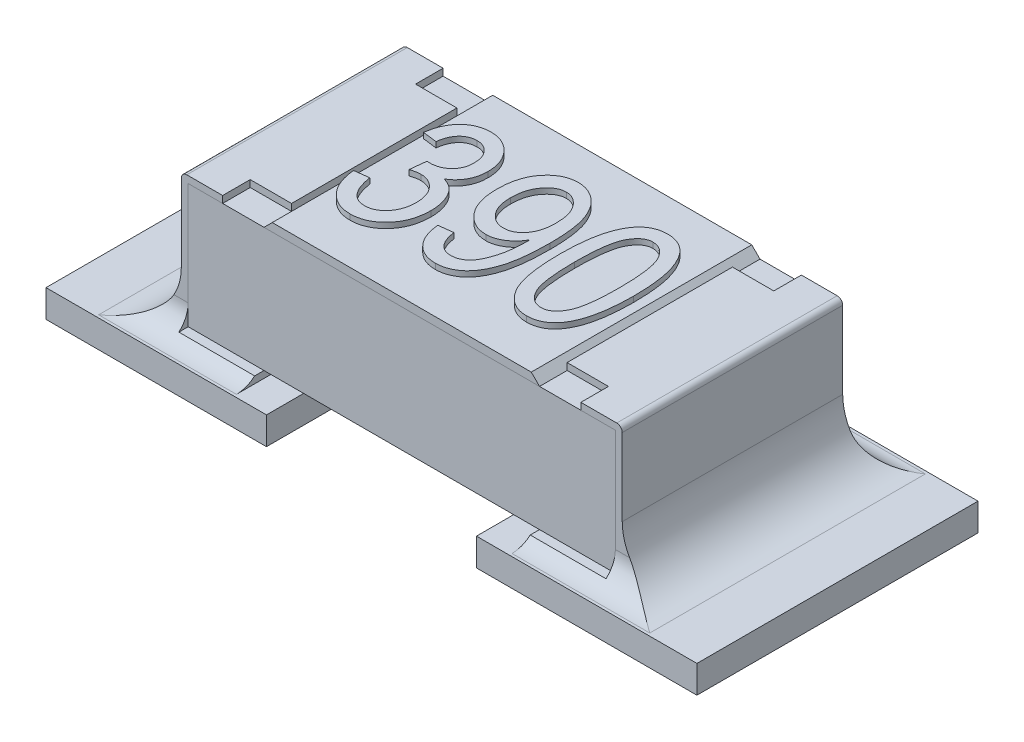
from build123d import *

# Parameters (mm, degrees)
SKETCH1_W             = 0.8
SKETCH1_H             = 0.45
BOSS_EXTRUDE1_DEPTH   = 0.775
BOSS_EXTRUDE2_DEPTH   = 0.4
BOSS_EXTRUDE2_2_DEPTH = 0.4
SKETCH3_W             = 0.15
SKETCH3_H             = 0.1
CUT_EXTRUDE1_DEPTH    = 0.025
BOSS_EXTRUDE3_DEPTH   = 0.4
SKETCH7_W             = 0.8
SKETCH7_H             = 1.02
BOSS_EXTRUDE5_DEPTH   = 0.1
FILLET3_R             = 0.2
FILLET4_R             = 0.2
FILLET5_R             = 0.1
FILLET6_R             = 0.1
BOSS_EXTRU_1_DEPTH    = 0.02


with BuildPart() as part:
    # Sketch1 → Boss-Extrude1 (new, symmetric)
    with BuildSketch(Plane(origin=(0, 0, 0), x_dir=(0, 0, -1), z_dir=(1, 0, 0))):
        with Locations((0, 0.35)):
            Rectangle(SKETCH1_W, SKETCH1_H)
    extrude(amount=BOSS_EXTRUDE1_DEPTH, both=True)


with BuildPart() as body_2:
    # Sketch2 → Boss-Extrude2 (new, symmetric)
    with BuildSketch(Plane.XY):
        with BuildLine():
            Line((-0.5, 0.6), (-0.78, 0.6))
            ThreePointArc((-0.78, 0.6), (-0.794142136, 0.594142136), (-0.8, 0.58))
            Line((-0.8, 0.58), (-0.8, 0.1))
            Line((-0.8, 0.1), (-0.5, 0.1))
            Line((-0.5, 0.1), (-0.5, 0.125))
            Line((-0.5, 0.125), (-0.775, 0.125))
            Line((-0.775, 0.125), (-0.775, 0.575))
            Line((-0.775, 0.575), (-0.5, 0.575))
            Line((-0.5, 0.575), (-0.5, 0.6))
        make_face()
    extrude(amount=BOSS_EXTRUDE2_DEPTH, both=True)


with BuildPart() as body_3:
    # Sketch2 → Boss-Extrude2 2 (new, symmetric)
    with BuildSketch(Plane.XY):
        with BuildLine():
            Line((0.5, 0.575), (0.5, 0.6))
            Line((0.5, 0.6), (0.78, 0.6))
            ThreePointArc((0.78, 0.6), (0.794142136, 0.594142136), (0.8, 0.58))
            Line((0.8, 0.58), (0.8, 0.1))
            Line((0.8, 0.1), (0.5, 0.1))
            Line((0.5, 0.1), (0.5, 0.125))
            Line((0.5, 0.125), (0.775, 0.125))
            Line((0.775, 0.125), (0.775, 0.575))
            Line((0.775, 0.575), (0.5, 0.575))
        make_face()
    extrude(amount=BOSS_EXTRUDE2_2_DEPTH, both=True)


with BuildPart() as cut_extrude1_tool:
    # Sketch3 → Cut-Extrude1 (new body)
    with BuildSketch(Plane(origin=(0, 0.6, 0), x_dir=(1, 0, 0), z_dir=(0, 1, 0))):
        with Locations((-0.575, 0.35)):
            Rectangle(SKETCH3_W, SKETCH3_H)
        with Locations((-0.575, -0.35)):
            Rectangle(SKETCH3_W, SKETCH3_H)
        with Locations((0.575, -0.35)):
            Rectangle(SKETCH3_W, SKETCH3_H)
        with Locations((0.575, 0.35)):
            Rectangle(SKETCH3_W, SKETCH3_H)
    extrude(amount=-CUT_EXTRUDE1_DEPTH)


with BuildPart() as body_2_1:
    add(body_2.part)

    # Cut-Extrude1: cut by cut_extrude1_tool
    add(cut_extrude1_tool.part, mode=Mode.SUBTRACT)



with BuildPart() as body_3_1:
    add(body_3.part)

    # Cut-Extrude1: cut by cut_extrude1_tool
    add(cut_extrude1_tool.part, mode=Mode.SUBTRACT)


with BuildPart() as body_4:
    # Sketch4 → Boss-Extrude3 (new, symmetric)
    with BuildSketch(Plane.XY):
        Polygon((-0.5, 0.575), (0.5, 0.575), (0.47, 0.605), (-0.47, 0.605), align=None)
    extrude(amount=BOSS_EXTRUDE3_DEPTH, both=True)

    # Esquisse2 → Boss.-Extru.1 (add)
    # profile 1 of 3: a face of its own
    with BuildSketch(Plane(origin=(0, 0.605, 0), x_dir=(1, 0, 0), z_dir=(0, 1, 0))):
        with BuildLine():
            Line((-0.465730847, -0.108858251), (-0.413782795, -0.102364745))
            add(Edge.make_bspline(
                [(-0.413782795, -0.102364745), (-0.413112807, -0.106295854), (-0.411807247, -0.113956147), (-0.409238482, -0.124979634), (-0.406434917, -0.135294754), (-0.403185523, -0.144804398), (-0.399643589, -0.153601456), (-0.395715823, -0.161629834), (-0.391324435, -0.16888819), (-0.386577518, -0.175380729), (-0.38146041, -0.181138198), (-0.375996387, -0.186122883), (-0.370134278, -0.190331218), (-0.363929963, -0.193833451), (-0.357285261, -0.196431554), (-0.350330728, -0.198414424), (-0.34296418, -0.199517263), (-0.337927194, -0.199682771), (-0.335353412, -0.199767342)],
                knots=[0, 0, 0, 0, 1.392235382, 2.712957193, 3.95076201, 5.123471921, 6.220028287, 7.260520794, 8.240826993, 9.178593426, 10.065213643, 10.926376853, 11.755607984, 12.580369742, 13.407158359, 14.241002189, 15.101193065, 16, 16, 16, 16], degree=3))
            add(Edge.make_bspline(
                [(-0.335353412, -0.199767342), (-0.332538353, -0.19971378), (-0.327005308, -0.199608502), (-0.318897007, -0.198040126), (-0.311019345, -0.195898939), (-0.303508158, -0.192563959), (-0.296231184, -0.188466115), (-0.289179307, -0.183522145), (-0.282629652, -0.177410194), (-0.27625154, -0.170691575), (-0.270368923, -0.163232894), (-0.265296718, -0.155086373), (-0.261024926, -0.146371416), (-0.257440303, -0.137192254), (-0.254875092, -0.127399682), (-0.252761962, -0.117188858), (-0.251701981, -0.106343944), (-0.251532173, -0.098950673), (-0.251445133, -0.095161011)],
                knots=[0, 0, 0, 0, 0.904038564, 1.776903143, 2.648138989, 3.525264603, 4.411852617, 5.332561374, 6.2875971, 7.288147468, 8.311042921, 9.337403868, 10.368883854, 11.429611823, 12.501164111, 13.621320171, 14.780729868, 16, 16, 16, 16], degree=3))
            add(Edge.make_bspline(
                [(-0.251445133, -0.095161011), (-0.25153714, -0.091607761), (-0.251716276, -0.084689696), (-0.252701551, -0.074570464), (-0.254506809, -0.064983483), (-0.257204132, -0.05595494), (-0.260398267, -0.047345761), (-0.264475323, -0.03933172), (-0.269286493, -0.031866947), (-0.274729563, -0.025004423), (-0.280738993, -0.018819667), (-0.287076675, -0.013314715), (-0.293845368, -0.008739927), (-0.300874508, -0.004887872), (-0.308355784, -0.002118976), (-0.316071181, 8.4992e-05), (-0.324187909, 0.00130226), (-0.329701668, 0.001454003), (-0.332512503, 0.001531359)],
                knots=[0, 0, 0, 0, 1.208507307, 2.352925112, 3.453685551, 4.520081629, 5.553915499, 6.572344605, 7.570902253, 8.569592363, 9.545641393, 10.499968035, 11.418701314, 12.319183888, 13.218416966, 14.125267075, 15.044288268, 16, 16, 16, 16], degree=3))
            add(Edge.make_bspline(
                [(-0.332512503, 0.001531359), (-0.335054222, 0.001451368), (-0.340472466, 0.001280848), (-0.349004264, -0.00019382), (-0.358446302, -0.00226645), (-0.36492643, -0.004300299), (-0.36832825, -0.005367991)],
                knots=[0, 0, 0, 0, 0.832645691, 1.774971563, 2.831945141, 4, 4, 4, 4], degree=3))
            Line((-0.36832825, -0.005367991), (-0.361834743, 0.053479411))
            Line((-0.361834743, 0.053479411), (-0.354022243, 0.052769184))
            add(Edge.make_bspline(
                [(-0.354022243, 0.052769184), (-0.351007427, 0.052803375), (-0.3451245, 0.052870094), (-0.336520608, 0.054103025), (-0.328313169, 0.05573649), (-0.320585221, 0.058215582), (-0.313242826, 0.06126306), (-0.30640038, 0.06512583), (-0.29993305, 0.069629935), (-0.293956478, 0.074775592), (-0.288591253, 0.080592975), (-0.283798464, 0.086838036), (-0.279836815, 0.093608382), (-0.27654485, 0.100771608), (-0.274020674, 0.108431244), (-0.272178554, 0.116547048), (-0.271199422, 0.125154849), (-0.27101847, 0.131027254), (-0.270925652, 0.134039476)],
                knots=[0, 0, 0, 0, 1.104467345, 2.155189185, 3.181695374, 4.170183668, 5.126157628, 6.092295424, 7.04536858, 8.012620263, 8.977961638, 9.942904556, 10.893715412, 11.848320646, 12.828840281, 13.845861792, 14.895045293, 16, 16, 16, 16], degree=3))
            add(Edge.make_bspline(
                [(-0.270925652, 0.134039476), (-0.271158483, 0.139435179), (-0.271605941, 0.149804754), (-0.275040698, 0.164574052), (-0.281025918, 0.177647183), (-0.289265332, 0.188824396), (-0.299180409, 0.19783145), (-0.310256724, 0.204581268), (-0.322540697, 0.208580551), (-0.331097189, 0.209072848), (-0.335454873, 0.209323567)],
                knots=[0, 0, 0, 0, 1.168747258, 2.246123166, 3.262822778, 4.26410748, 5.234436762, 6.148309006, 7.056963545, 8, 8, 8, 8], degree=3))
            add(Edge.make_bspline(
                [(-0.335454873, 0.209323567), (-0.339982901, 0.209113033), (-0.348791484, 0.208703473), (-0.361387188, 0.204796436), (-0.372975385, 0.198811303), (-0.381422708, 0.191612698), (-0.387408859, 0.184797154), (-0.391632537, 0.179053945), (-0.395385645, 0.172667561), (-0.39856643, 0.165580977), (-0.401627761, 0.157989828), (-0.403792773, 0.149635141), (-0.405955263, 0.14077154), (-0.4068352, 0.134590959), (-0.407289289, 0.131401489)],
                knots=[0, 0, 0, 0, 1.389180941, 2.702438466, 4.019316734, 5.377896697, 6.085434137, 6.807430375, 7.567469407, 8.358691296, 9.195188439, 10.081130764, 11.009773198, 12, 12, 12, 12], degree=3))
            Line((-0.407289289, 0.131401489), (-0.459237341, 0.137894996))
            add(Edge.make_bspline(
                [(-0.459237341, 0.137894996), (-0.458386725, 0.142845406), (-0.456727429, 0.152502178), (-0.453260772, 0.166397742), (-0.44913499, 0.179379068), (-0.444139657, 0.191374675), (-0.438467682, 0.202488701), (-0.432050369, 0.212674243), (-0.424971305, 0.221998173), (-0.416984552, 0.230202962), (-0.408495978, 0.237510554), (-0.399500655, 0.243821526), (-0.39015896, 0.249253588), (-0.380316923, 0.25362975), (-0.370066957, 0.257099842), (-0.359357741, 0.259528187), (-0.348244302, 0.260963741), (-0.340701236, 0.261168011), (-0.336875328, 0.261271619)],
                knots=[0, 0, 0, 0, 1.259750421, 2.457396855, 3.589696629, 4.673763457, 5.713494597, 6.716289503, 7.690389722, 8.644478697, 9.583164327, 10.496506905, 11.397350125, 12.289843847, 13.194037124, 14.107891875, 15.040306322, 16, 16, 16, 16], degree=3))
            add(Edge.make_bspline(
                [(-0.336875328, 0.261271619), (-0.332844064, 0.261152706), (-0.324913169, 0.260918763), (-0.313256414, 0.259123737), (-0.302045795, 0.256325888), (-0.291311157, 0.252246796), (-0.281147915, 0.246873647), (-0.271305727, 0.240572938), (-0.261950545, 0.233023939), (-0.25322899, 0.224349983), (-0.245223381, 0.214858231), (-0.238201607, 0.204659864), (-0.232170532, 0.193927052), (-0.227381442, 0.18250432), (-0.22363811, 0.170506984), (-0.22090271, 0.157915535), (-0.219227721, 0.144704426), (-0.219062239, 0.135701715), (-0.2189776, 0.131097106)],
                knots=[0, 0, 0, 0, 0.987546189, 1.94284647, 2.883618689, 3.814886987, 4.749064414, 5.696240478, 6.674807358, 7.688712876, 8.706405422, 9.713376545, 10.718845743, 11.717906576, 12.742863162, 13.794678478, 14.872046121, 16, 16, 16, 16], degree=3))
            add(Edge.make_bspline(
                [(-0.2189776, 0.131097106), (-0.219133893, 0.12553723), (-0.219439131, 0.114678872), (-0.222381301, 0.09892791), (-0.227050518, 0.084150815), (-0.233562923, 0.070445878), (-0.241678138, 0.057883508), (-0.251425525, 0.046771364), (-0.262549879, 0.036921642), (-0.271008348, 0.031747145), (-0.275288477, 0.029128762)],
                knots=[0, 0, 0, 0, 1.090109576, 2.128968013, 3.132278696, 4.123864162, 5.09769889, 6.057339906, 7.016980922, 8, 8, 8, 8], degree=3))
            add(Edge.make_bspline(
                [(-0.275288477, 0.029128762), (-0.271356899, 0.027919056), (-0.263675094, 0.025555446), (-0.253077464, 0.020232713), (-0.243414234, 0.014051368), (-0.234779961, 0.006637104), (-0.227100626, -0.002012587), (-0.220243477, -0.011957767), (-0.214351943, -0.023293485), (-0.209029241, -0.035737208), (-0.204858001, -0.049280075), (-0.201653268, -0.063651321), (-0.199835984, -0.078846612), (-0.199611759, -0.089237754), (-0.199497081, -0.094552245)],
                knots=[0, 0, 0, 0, 0.945190562, 1.846782401, 2.71900073, 3.580139159, 4.456653473, 5.37426406, 6.352713278, 7.392141409, 8.485180558, 9.608884637, 10.777077804, 12, 12, 12, 12], degree=3))
            add(Edge.make_bspline(
                [(-0.199497081, -0.094552245), (-0.199596583, -0.100206655), (-0.199790841, -0.111245814), (-0.201822335, -0.12742587), (-0.204896868, -0.142815205), (-0.209282638, -0.157468828), (-0.214950046, -0.171273371), (-0.221948905, -0.18430778), (-0.230131625, -0.196573403), (-0.239552704, -0.207898211), (-0.249854098, -0.218037877), (-0.260648779, -0.227099023), (-0.27201825, -0.234700597), (-0.283865675, -0.240980511), (-0.296244045, -0.245749208), (-0.309087119, -0.249234387), (-0.322469202, -0.251292842), (-0.331558508, -0.251573269), (-0.3361651, -0.251715394)],
                knots=[0, 0, 0, 0, 1.16797173, 2.280242353, 3.364490462, 4.408173669, 5.436152277, 6.443028727, 7.460738993, 8.478233232, 9.481512989, 10.444418881, 11.386528098, 12.302557467, 13.209825675, 14.12198051, 15.04819242, 16, 16, 16, 16], degree=3))
            add(Edge.make_bspline(
                [(-0.3361651, -0.251715394), (-0.340433302, -0.251602688), (-0.348840747, -0.25138068), (-0.361184358, -0.249495111), (-0.373028706, -0.246468911), (-0.384329246, -0.242152829), (-0.395217976, -0.236755504), (-0.405526134, -0.230035031), (-0.415382031, -0.222118498), (-0.424643085, -0.213060002), (-0.433105877, -0.202919877), (-0.440792513, -0.191987861), (-0.447544092, -0.180206271), (-0.453039881, -0.167459779), (-0.457743007, -0.15400335), (-0.461504378, -0.139729734), (-0.464262752, -0.124598771), (-0.465234684, -0.11417798), (-0.465730847, -0.108858251)],
                knots=[0, 0, 0, 0, 0.959274814, 1.889566238, 2.800731978, 3.703256649, 4.604498869, 5.528396462, 6.464265966, 7.442996794, 8.436156864, 9.429840861, 10.444772988, 11.483305447, 12.546329121, 13.647537524, 14.799087218, 16, 16, 16, 16], degree=3))
        make_face()
    # profile 2 of 3: a face of its own
    with BuildSketch(Plane(origin=(0, 0.605, 0), x_dir=(1, 0, 0), z_dir=(0, 1, 0))):
        with BuildLine():
            Line((-0.141055522, -0.128338771), (-0.08910747, -0.121845264))
            add(Edge.make_bspline(
                [(-0.08910747, -0.121845264), (-0.088068623, -0.127965427), (-0.086103422, -0.13954302), (-0.081102953, -0.155492384), (-0.074892952, -0.169124662), (-0.067129306, -0.180350872), (-0.057838762, -0.189108054), (-0.047095732, -0.195365869), (-0.034936155, -0.199134245), (-0.026364164, -0.199551831), (-0.021940263, -0.199767342)],
                knots=[0, 0, 0, 0, 1.309725382, 2.477624782, 3.519252249, 4.462492528, 5.34180128, 6.193195808, 7.067530017, 8, 8, 8, 8], degree=3))
            add(Edge.make_bspline(
                [(-0.021940263, -0.199767342), (-0.017859964, -0.199550958), (-0.009770373, -0.199121955), (0.002005239, -0.195717431), (0.013108053, -0.190193535), (0.021867058, -0.184007304), (0.028334485, -0.177694524), (0.033290536, -0.172238138), (0.037809282, -0.165721246), (0.042261863, -0.158496361), (0.046410991, -0.150352509), (0.050494334, -0.141483377), (0.054172511, -0.131673958), (0.05918422, -0.117409177), (0.064356962, -0.098030789), (0.06862994, -0.073172804), (0.071307558, -0.046518032), (0.071638918, -0.028135681), (0.071809737, -0.018659388)],
                knots=[0, 0, 0, 0, 0.871681479, 1.728193698, 2.598433288, 3.51585727, 4.0070026, 4.529633168, 5.089671721, 5.700050678, 6.343889226, 7.043128753, 7.787355008, 8.583454758, 10.276770505, 12.068987891, 13.973522342, 16, 16, 16, 16], degree=3))
            Line((0.071809737, -0.018659388), (0.071809737, -0.006382602))
            add(Edge.make_bspline(
                [(0.071809737, -0.006382602), (0.069091388, -0.011097337), (0.063725991, -0.020403142), (0.053624005, -0.032819342), (0.042296239, -0.04377628), (0.029793221, -0.053087763), (0.016465381, -0.060406819), (0.002914963, -0.065924959), (-0.010896401, -0.069195988), (-0.020165262, -0.069664094), (-0.024781172, -0.069897212)],
                knots=[0, 0, 0, 0, 1.076943371, 2.125638765, 3.158845653, 4.193572763, 5.204435146, 6.163898621, 7.085618246, 8, 8, 8, 8], degree=3))
            add(Edge.make_bspline(
                [(-0.024781172, -0.069897212), (-0.028882538, -0.069758097), (-0.037000498, -0.069482743), (-0.048942465, -0.067361774), (-0.06053868, -0.064070781), (-0.071571841, -0.059095937), (-0.082267664, -0.052985962), (-0.092415397, -0.045386851), (-0.102215862, -0.036503277), (-0.111460363, -0.026315577), (-0.120032271, -0.014972746), (-0.127412495, -0.002468195), (-0.133636778, 0.011037902), (-0.138669305, 0.025532455), (-0.142770778, 0.040982515), (-0.145572121, 0.057485608), (-0.147167704, 0.074991254), (-0.147419706, 0.086992059), (-0.147549029, 0.093150677)],
                knots=[0, 0, 0, 0, 0.86465958, 1.711446896, 2.551263658, 3.400931007, 4.257488752, 5.144979063, 6.069240711, 7.043889745, 8.042652401, 9.063041585, 10.100422143, 11.174417838, 12.295707709, 13.468554313, 14.700903177, 16, 16, 16, 16], degree=3))
            add(Edge.make_bspline(
                [(-0.147549029, 0.093150677), (-0.147431564, 0.099479614), (-0.147201837, 0.111857187), (-0.145431446, 0.129886681), (-0.142722023, 0.146924998), (-0.138427247, 0.16281844), (-0.133381692, 0.177797831), (-0.126905536, 0.191660586), (-0.119408641, 0.204560783), (-0.11067379, 0.21625239), (-0.101195479, 0.226787472), (-0.091079887, 0.23596893), (-0.080549837, 0.243885155), (-0.069354671, 0.250174662), (-0.057765283, 0.255262925), (-0.045591044, 0.258625517), (-0.032982676, 0.260896455), (-0.024385654, 0.261145125), (-0.020012503, 0.261271619)],
                knots=[0, 0, 0, 0, 1.28857615, 2.520082744, 3.686305779, 4.797202427, 5.868826455, 6.901108228, 7.907493629, 8.90202596, 9.867517396, 10.788992686, 11.680218227, 12.543873392, 13.398473814, 14.25085117, 15.110239307, 16, 16, 16, 16], degree=3))
            add(Edge.make_bspline(
                [(-0.020012503, 0.261271619), (-0.016896701, 0.261195857), (-0.010675219, 0.26104458), (-0.001451943, 0.259754161), (0.007622483, 0.257860818), (0.016534826, 0.255104264), (0.02522399, 0.251418717), (0.03378138, 0.24700989), (0.042267752, 0.241970213), (0.050418301, 0.235947712), (0.058379381, 0.229268388), (0.065872865, 0.22175736), (0.072867011, 0.213470407), (0.079543688, 0.204572185), (0.085438194, 0.19471257), (0.091203851, 0.184288747), (0.096321883, 0.173004084), (0.101049499, 0.160930537), (0.105240224, 0.147789381), (0.108875705, 0.133392055), (0.111854583, 0.11762654), (0.114421799, 0.100540463), (0.116270751, 0.082082564), (0.117718536, 0.062258527), (0.118491274, 0.041073469), (0.118618979, 0.026491317), (0.118684737, 0.018982658)],
                knots=[0, 0, 0, 0, 0.71982096, 1.437303798, 2.148671553, 2.860726122, 3.5894893, 4.327127712, 5.084546776, 5.867862187, 6.666549548, 7.484587174, 8.316328227, 9.17150421, 10.052303838, 10.968733071, 11.923593905, 12.913579202, 13.964198915, 15.109293659, 16.343376022, 17.671051532, 19.10143247, 20.629623286, 22.264521701, 24, 24, 24, 24], degree=3))
            add(Edge.make_bspline(
                [(0.118684737, 0.018982658), (0.118629421, 0.010594404), (0.118522101, -0.00568005), (0.117605706, -0.029399121), (0.116072876, -0.051658149), (0.114124024, -0.072519272), (0.111399137, -0.091883593), (0.108008176, -0.109809258), (0.10428227, -0.126352625), (0.099655614, -0.141468202), (0.094494639, -0.155327857), (0.089203736, -0.168265283), (0.083292585, -0.180193379), (0.076905499, -0.191110548), (0.070204176, -0.201167473), (0.063011822, -0.210199478), (0.055361105, -0.21826573), (0.04733953, -0.225384507), (0.038965878, -0.231592658), (0.030371248, -0.237005339), (0.021457725, -0.241435091), (0.012425898, -0.245299121), (0.00300659, -0.248069513), (-0.006603291, -0.250259486), (-0.016497656, -0.251476882), (-0.023154769, -0.25163553), (-0.026506009, -0.251715394)],
                knots=[0, 0, 0, 0, 1.764807986, 3.42398863, 4.99306403, 6.458696006, 7.831295522, 9.105472131, 10.296422921, 11.39714146, 12.428197542, 13.407419317, 14.336630445, 15.226313195, 16.067043525, 16.877164758, 17.652279824, 18.403342349, 19.130566392, 19.843339087, 20.537068434, 21.222906937, 21.90719335, 22.599498013, 23.294976811, 24, 24, 24, 24], degree=3))
            add(Edge.make_bspline(
                [(-0.026506009, -0.251715394), (-0.030299964, -0.25162538), (-0.037750302, -0.251448615), (-0.048675562, -0.249832466), (-0.059135997, -0.247480073), (-0.069090444, -0.243964799), (-0.078574885, -0.239476471), (-0.087594275, -0.234012491), (-0.096098109, -0.227519127), (-0.104132551, -0.22012637), (-0.111500742, -0.211719215), (-0.118150568, -0.202420146), (-0.123948418, -0.192213538), (-0.128880708, -0.181105179), (-0.133149425, -0.169167597), (-0.136734162, -0.156369126), (-0.139316174, -0.142642409), (-0.140466518, -0.133182487), (-0.141055522, -0.128338771)],
                knots=[0, 0, 0, 0, 0.974221956, 1.913117753, 2.832138983, 3.725325793, 4.619357623, 5.523969086, 6.429456606, 7.364160882, 8.324683532, 9.296460859, 10.296689072, 11.335178463, 12.415402788, 13.551768977, 14.746444432, 16, 16, 16, 16], degree=3))
        make_face()
        with BuildLine():
            add(Edge.make_bspline(
                [(0.066736685, 0.094469671), (0.066654776, 0.098801218), (0.066494517, 0.107275997), (0.0653652, 0.119611789), (0.063576822, 0.131289058), (0.060938941, 0.142208657), (0.057615912, 0.152453857), (0.053425213, 0.161913482), (0.048556732, 0.170692666), (0.042976572, 0.178684686), (0.036939341, 0.185826162), (0.030614519, 0.192111932), (0.024008234, 0.197353086), (0.017284384, 0.201838112), (0.01024133, 0.205199951), (0.002934943, 0.207547008), (-0.004566449, 0.209006843), (-0.009657134, 0.209218061), (-0.012200003, 0.209323567)],
                knots=[0, 0, 0, 0, 1.345999961, 2.633481834, 3.846522151, 5.014086171, 6.12088659, 7.189137531, 8.224301127, 9.236041944, 10.213065705, 11.127237019, 12.002136993, 12.83006775, 13.63396595, 14.418389675, 15.209963153, 16, 16, 16, 16], degree=3))
            add(Edge.make_bspline(
                [(-0.012200003, 0.209323567), (-0.014879083, 0.209226981), (-0.020213191, 0.209034675), (-0.028061522, 0.207457274), (-0.035712696, 0.204892356), (-0.043066556, 0.201197611), (-0.050291861, 0.196596635), (-0.057136478, 0.190838363), (-0.063914694, 0.184207328), (-0.070312105, 0.176547083), (-0.076279401, 0.16809935), (-0.081518149, 0.158873663), (-0.085846381, 0.148926014), (-0.089361126, 0.138315473), (-0.092297145, 0.127084088), (-0.094093903, 0.115110658), (-0.095396242, 0.102479796), (-0.095531588, 0.093830776), (-0.095600977, 0.089396619)],
                knots=[0, 0, 0, 0, 0.795597862, 1.584053309, 2.369106213, 3.187177883, 4.023566861, 4.908945974, 5.83998388, 6.838605549, 7.870313796, 8.9100199, 9.985637853, 11.088521482, 12.229358934, 13.430623134, 14.682738284, 16, 16, 16, 16], degree=3))
            add(Edge.make_bspline(
                [(-0.095600977, 0.089396619), (-0.095516097, 0.085403645), (-0.095350311, 0.077604681), (-0.094264088, 0.066233395), (-0.092297055, 0.055492281), (-0.08970191, 0.045368952), (-0.086351436, 0.035841282), (-0.082181737, 0.026960594), (-0.077176717, 0.018727399), (-0.071541315, 0.011143017), (-0.065323719, 0.004384681), (-0.058881271, -0.001697815), (-0.051933425, -0.006646112), (-0.044757414, -0.010744723), (-0.03734773, -0.014078508), (-0.0295394, -0.016235802), (-0.02149413, -0.017782134), (-0.015995528, -0.01789306), (-0.013214613, -0.01794916)],
                knots=[0, 0, 0, 0, 1.270391188, 2.481292313, 3.629423926, 4.741182195, 5.802977916, 6.837826839, 7.856438293, 8.863562247, 9.838501743, 10.775102984, 11.676942478, 12.544429056, 13.402050266, 14.253371081, 15.116643449, 16, 16, 16, 16], degree=3))
            add(Edge.make_bspline(
                [(-0.013214613, -0.01794916), (-0.010471518, -0.017833811), (-0.005055574, -0.017606066), (0.002916391, -0.016335547), (0.010490816, -0.013878363), (0.017855608, -0.010816153), (0.024789861, -0.006553653), (0.031381025, -0.001444979), (0.037757397, 0.004483385), (0.043668931, 0.011377892), (0.049213113, 0.019041101), (0.053804443, 0.027668975), (0.057928225, 0.036887278), (0.061145122, 0.046936229), (0.063667692, 0.057726694), (0.065496762, 0.069287757), (0.06646454, 0.081635272), (0.066644142, 0.090105313), (0.066736685, 0.094469671)],
                knots=[0, 0, 0, 0, 0.854962158, 1.688029758, 2.504410095, 3.330252108, 4.166776435, 5.030713634, 5.925137581, 6.873583428, 7.855774289, 8.86472059, 9.911937097, 10.998017063, 12.145369077, 13.361241875, 14.64032716, 16, 16, 16, 16], degree=3))
        make_face(mode=Mode.SUBTRACT)
    # profile 3 of 3: a face of its own
    with BuildSketch(Plane(origin=(0, 0.605, 0), x_dir=(1, 0, 0), z_dir=(0, 1, 0))):
        with BuildLine():
            add(Edge.make_bspline(
                [(0.170632789, 0.00457519), (0.170715281, 0.01479126), (0.17087546, 0.034628409), (0.172530877, 0.063399949), (0.17514196, 0.090278959), (0.178692681, 0.115229398), (0.183498163, 0.138255011), (0.189157098, 0.15939274), (0.196107399, 0.178575365), (0.203930391, 0.195885139), (0.212901565, 0.21122541), (0.222791904, 0.224648892), (0.233894793, 0.235937722), (0.245904083, 0.245324824), (0.259058682, 0.252476152), (0.273171359, 0.257615666), (0.288294284, 0.260717058), (0.298729631, 0.261084261), (0.304054056, 0.261271619)],
                knots=[0, 0, 0, 0, 1.522295809, 2.955932353, 4.292935845, 5.545987552, 6.709403679, 7.796379217, 8.803980711, 9.746667296, 10.623167879, 11.447716403, 12.224665142, 12.975696349, 13.710987297, 14.4460191, 15.207112772, 16, 16, 16, 16], degree=3))
            add(Edge.make_bspline(
                [(0.304054056, 0.261271619), (0.308798968, 0.261119405), (0.31811689, 0.260820492), (0.331714096, 0.258355488), (0.344503146, 0.254161939), (0.356493701, 0.248334155), (0.367649338, 0.240809961), (0.378079815, 0.231712272), (0.38767083, 0.22085766), (0.393224555, 0.212703293), (0.396079218, 0.208511879)],
                knots=[0, 0, 0, 0, 1.02435884, 2.0116063, 2.972586715, 3.92329494, 4.881606269, 5.870473939, 6.905405214, 8, 8, 8, 8], degree=3))
            add(Edge.make_bspline(
                [(0.396079218, 0.208511879), (0.399383571, 0.202860902), (0.406255323, 0.191109101), (0.414460529, 0.171419216), (0.42137676, 0.149427268), (0.427208245, 0.125063264), (0.431367976, 0.098276968), (0.434660149, 0.069172575), (0.436565497, 0.037676929), (0.436763796, 0.015873733), (0.436866556, 0.00457519)],
                knots=[0, 0, 0, 0, 0.745747152, 1.550859881, 2.42529298, 3.372802996, 4.404287875, 5.514077945, 6.711780846, 8, 8, 8, 8], degree=3))
            add(Edge.make_bspline(
                [(0.436866556, 0.00457519), (0.436785064, -0.005573368), (0.436626857, -0.025275587), (0.434954873, -0.053910105), (0.432378579, -0.080658499), (0.428779632, -0.10553284), (0.424018716, -0.128501924), (0.41828459, -0.149633905), (0.411551199, -0.168919426), (0.403619919, -0.186231046), (0.394780809, -0.201660817), (0.384722691, -0.214948272), (0.373887382, -0.226438872), (0.361722207, -0.23562265), (0.348657364, -0.242976397), (0.334449575, -0.248029288), (0.319276239, -0.251174149), (0.308804717, -0.25153216), (0.303445289, -0.251715394)],
                knots=[0, 0, 0, 0, 1.513874866, 2.939007974, 4.277477108, 5.521918538, 6.686610019, 7.774777114, 8.786532326, 9.730252297, 10.61206932, 11.433487149, 12.211385775, 12.960169701, 13.698700869, 14.439280195, 15.201208188, 16, 16, 16, 16], degree=3))
            add(Edge.make_bspline(
                [(0.303445289, -0.251715394), (0.298665094, -0.251535975), (0.289266692, -0.251183218), (0.275476763, -0.248501144), (0.262425349, -0.243876751), (0.250043505, -0.237523555), (0.238314772, -0.229401051), (0.227382453, -0.219338145), (0.216982421, -0.207599728), (0.207239757, -0.19396939), (0.198435777, -0.178096762), (0.190993587, -0.159604049), (0.184653069, -0.138579583), (0.179621562, -0.114938484), (0.175386544, -0.08877738), (0.172724999, -0.059965056), (0.170960895, -0.028557109), (0.170745014, -0.006757381), (0.170632789, 0.00457519)],
                knots=[0, 0, 0, 0, 0.713782411, 1.403376538, 2.088831486, 2.775699897, 3.476400496, 4.213162367, 4.989742879, 5.815463779, 6.710980744, 7.6941898, 8.787315853, 9.987366569, 11.302150399, 12.743876293, 14.307306722, 16, 16, 16, 16], degree=3))
        make_face()
        with BuildLine():
            add(Edge.make_bspline(
                [(0.222580841, 0.004778112), (0.222671423, -0.004962844), (0.22284446, -0.023570963), (0.223795402, -0.050273881), (0.225592775, -0.074440086), (0.228089142, -0.096145725), (0.231254125, -0.115301137), (0.235160442, -0.132011786), (0.239815203, -0.146209724), (0.245291529, -0.158097103), (0.251364396, -0.167965156), (0.257851, -0.176373903), (0.264557947, -0.183666527), (0.271889552, -0.189491854), (0.279501136, -0.194202042), (0.287686824, -0.19727545), (0.296157875, -0.199493814), (0.302010065, -0.199675523), (0.304967205, -0.199767342)],
                knots=[0, 0, 0, 0, 1.930873368, 3.688541263, 5.295281011, 6.732986767, 8.018032389, 9.141589856, 10.131594649, 10.974379403, 11.729767228, 12.422984227, 13.077418253, 13.687793181, 14.274134012, 14.843047171, 15.415386244, 16, 16, 16, 16], degree=3))
            add(Edge.make_bspline(
                [(0.304967205, -0.199767342), (0.307754755, -0.19967107), (0.31330521, -0.199479377), (0.321396024, -0.197283662), (0.329195942, -0.194062792), (0.336573874, -0.189401372), (0.343519227, -0.183405877), (0.350126132, -0.176126804), (0.356404425, -0.167556151), (0.362424933, -0.157540122), (0.367843075, -0.145592351), (0.37245162, -0.131326946), (0.376329459, -0.114621658), (0.379537126, -0.095476215), (0.381860981, -0.073856395), (0.383721462, -0.049836144), (0.384647715, -0.023333722), (0.384825652, -0.004861208), (0.384918504, 0.004778112)],
                knots=[0, 0, 0, 0, 0.556098029, 1.107279675, 1.665020537, 2.239289732, 2.843790749, 3.494855459, 4.20099618, 4.965402842, 5.827994078, 6.818278647, 7.958442113, 9.254955883, 10.697998423, 12.305588537, 14.072183745, 16, 16, 16, 16], degree=3))
            add(Edge.make_bspline(
                [(0.384918504, 0.004778112), (0.384826066, 0.014518953), (0.38464884, 0.033194439), (0.383718362, 0.059932684), (0.381888376, 0.084163121), (0.379436176, 0.105841815), (0.376210526, 0.125018143), (0.372381575, 0.141717126), (0.367650706, 0.155886496), (0.362252151, 0.167750164), (0.35605568, 0.177530431), (0.349728957, 0.186066808), (0.342795784, 0.193179002), (0.335508271, 0.199101273), (0.327760282, 0.203716122), (0.319517818, 0.207013805), (0.310844963, 0.208998194), (0.304909726, 0.209214654), (0.301923374, 0.209323567)],
                knots=[0, 0, 0, 0, 1.926173374, 3.692928135, 5.28908838, 6.72993665, 8.005261178, 9.132588719, 10.113846285, 10.954579593, 11.702439438, 12.399284011, 13.051919516, 13.660808713, 14.251466784, 14.827675714, 15.41013748, 16, 16, 16, 16], degree=3))
            add(Edge.make_bspline(
                [(0.301923374, 0.209323567), (0.29913537, 0.209229838), (0.29361687, 0.209044314), (0.285593326, 0.206839344), (0.277895922, 0.203615308), (0.270572037, 0.198933153), (0.263714085, 0.192853165), (0.257053603, 0.185619176), (0.250913, 0.176971227), (0.244870415, 0.16704689), (0.239547287, 0.155067165), (0.234931593, 0.140826575), (0.231219243, 0.124091318), (0.227938784, 0.105003485), (0.225644625, 0.083411294), (0.22377595, 0.059392779), (0.222852186, 0.03288983), (0.222673883, 0.014417392), (0.222580841, 0.004778112)],
                knots=[0, 0, 0, 0, 0.557102101, 1.102712893, 1.655222221, 2.224793741, 2.834805151, 3.487045402, 4.190458401, 4.956245252, 5.811421647, 6.809929224, 7.950602775, 9.242777249, 10.688425301, 12.298918027, 14.068702942, 16, 16, 16, 16], degree=3))
        make_face(mode=Mode.SUBTRACT)
    extrude(amount=BOSS_EXTRU_1_DEPTH)


with BuildPart() as body_2_2:
    add(body_2_1.part)

    add(body_3_1.part)  # Boss-Extrude5 merges body 3
    # Sketch7 → Boss-Extrude5 (add)
    with BuildSketch(Plane(origin=(0, 0, 0), x_dir=(1, 0, 0), z_dir=(0, 1, 0))):
        with Locations((-0.781, 0)):
            Rectangle(SKETCH7_W, SKETCH7_H)
        with Locations((0.781, 0)):
            Rectangle(SKETCH7_W, SKETCH7_H)
    extrude(amount=BOSS_EXTRUDE5_DEPTH)

    # Fillet3
    fillet3_edges = [body_2_2.edges().sort_by_distance(p)[0] for p in [
        (-0.8, 0.1, 0),
    ]]
    fillet(fillet3_edges, radius=FILLET3_R)

    # Fillet4
    fillet4_edges = [body_2_2.edges().sort_by_distance(p)[0] for p in [
        (0.8, 0.1, 0),
    ]]
    fillet(fillet4_edges, radius=FILLET4_R)

    # Fillet5
    fillet5_edges = [body_2_2.edges().sort_by_distance(p)[0] for p in [
        (0.75, 0.1, 0.4),
    ]]
    fillet(fillet5_edges, radius=FILLET5_R)
    fillet5_2_edges = [body_2_2.edges().sort_by_distance(p)[0] for p in [
        (0.75, 0.1, -0.4),
    ]]
    fillet(fillet5_2_edges, radius=FILLET5_R)

    # Fillet6
    fillet6_edges = [body_2_2.edges().sort_by_distance(p)[0] for p in [
        (-0.75, 0.1, -0.4),
    ]]
    fillet(fillet6_edges, radius=FILLET6_R)
    fillet6_2_edges = [body_2_2.edges().sort_by_distance(p)[0] for p in [
        (-0.75, 0.1, 0.4),
    ]]
    fillet(fillet6_2_edges, radius=FILLET6_R)


solid = Compound([part.part, body_4.part, body_2_2.part])
